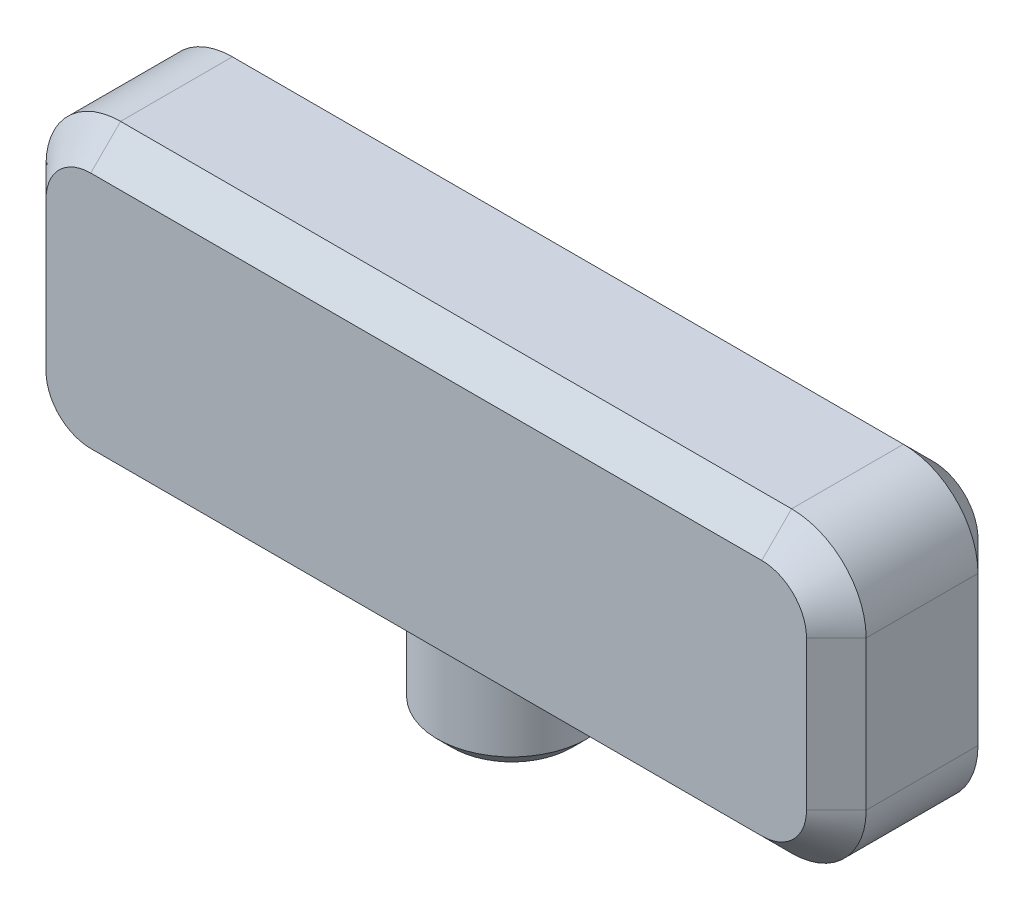
from build123d import *

# Parameters (mm, degrees)
SKETCH1_W                = 139.7
SKETCH1_H                = 50.8
SKETCH1_R                = 5.715
BOSS_EXTRUDE1_DEPTH      = 22.86
BOSS_EXTRUDE2_START      = 22.86
BOSS_EXTRUDE2_OUTLINE_W  = 139.7
BOSS_EXTRUDE2_OUTLINE_H  = 50.8
BOSS_EXTRUDE2_DEPTH      = 6.35
EXTRUDE_THIN1_START      = -7.62
SKETCH1_4_R              = 13.335
SKETCH1_4_R_2            = 5.715
EXTRUDE_THIN1_DEPTH      = 7.62
FILLET1_R                = 12.7
CHAMFER1_SIZE            = 5.08
CHAMFER3_SIZE            = 2.54
BOSS_EXTRUDE3_DEPTH      = 12.7
BOSS_EXTRUDE3_DEPTH_BACK = 12.7
SKETCH2_R                = 12.7
SKETCH2_R_2              = 5.08
CUT_EXTRUDE1_START       = -26.67
SKETCH2_2_R              = 5.08
CUT_EXTRUDE1_DEPTH       = 26.67
CHAMFER2_SIZE            = 2.54


# Read off the part's stored shape, not the designer's step: Boss-Extrude2
with BuildPart() as part:
    # Sketch1 → Boss-Extrude1 (new body)
    with BuildSketch(Plane.XY):
        Rectangle(SKETCH1_W, SKETCH1_H)
        with Locations((44.45, 0)):
            Circle(SKETCH1_R, mode=Mode.SUBTRACT)
        with Locations((-44.45, 0)):
            Circle(SKETCH1_R, mode=Mode.SUBTRACT)
    extrude(amount=BOSS_EXTRUDE1_DEPTH)

    # Boss-Extrude2 outline → Boss-Extrude2 (add)
    with BuildSketch(Plane.XY.offset(BOSS_EXTRUDE2_START)):
        Rectangle(BOSS_EXTRUDE2_OUTLINE_W, BOSS_EXTRUDE2_OUTLINE_H)
    extrude(amount=BOSS_EXTRUDE2_DEPTH)

    # Sketch1<4> → Extrude-Thin1 (add)
    # profile 1 of 2: a face of its own
    with BuildSketch(Plane.XY.offset(EXTRUDE_THIN1_START)):
        with Locations((44.45, 0)):
            Circle(SKETCH1_4_R)
        with Locations((44.45, 0)):
            Circle(SKETCH1_4_R_2, mode=Mode.SUBTRACT)
    # profile 2 of 2: a face of its own
    with BuildSketch(Plane.XY.offset(EXTRUDE_THIN1_START)):
        with Locations((-44.45, 0)):
            Circle(SKETCH1_4_R)
        with Locations((-44.45, 0)):
            Circle(SKETCH1_4_R_2, mode=Mode.SUBTRACT)
    extrude(amount=EXTRUDE_THIN1_DEPTH)

    # Fillet1
    fillet1_edges = [part.edges().sort_by_distance(p)[0] for p in [
        (-69.85, 25.4, 14.605),
        (69.85, 25.4, 14.605),
        (69.85, -25.4, 14.605),
        (-69.85, -25.4, 14.605),
    ]]
    fillet(fillet1_edges, radius=FILLET1_R)

    # Chamfer1
    chamfer1_edges = [part.edges().sort_by_distance(p)[0] for p in [
        (0, -25.4, 0),
        (0, -25.4, 29.21),
        (-69.85, 0, 0),
        (0, 25.4, 0),
        (69.85, 0, 0),
        (-66.130256121, 21.680256121, 0),
        (66.130256121, 21.680256121, 0),
        (66.130256121, -21.680256121, 0),
        (-66.130256121, -21.680256121, 0),
        (-69.85, 0, 29.21),
        (69.85, 0, 29.21),
        (0, 25.4, 29.21),
        (-66.130256121, 21.680256121, 29.21),
        (66.130256121, 21.680256121, 29.21),
        (66.130256121, -21.680256121, 29.21),
        (-66.130256121, -21.680256121, 29.21),
    ]]
    chamfer(chamfer1_edges, length=CHAMFER1_SIZE)

    # Chamfer3
    chamfer3_edges = [part.edges().sort_by_distance(p)[0] for p in [
        (31.115, 0, -7.62),
        (38.735, 0, -7.62),
        (-57.785, 0, -7.62),
        (-50.165, 0, -7.62),
    ]]
    chamfer(chamfer3_edges, length=CHAMFER3_SIZE)

    # Sketch2 → Boss-Extrude3 (add, two sides: drawn at the far end of the back side and taken through both)
    with BuildSketch(Plane.XZ.offset(25.4).offset(-BOSS_EXTRUDE3_DEPTH_BACK)):
        with Locations((0, 14.605)):
            Circle(SKETCH2_R)
        with Locations((0, 14.605)):
            Circle(SKETCH2_R_2, mode=Mode.SUBTRACT)
    extrude(amount=BOSS_EXTRUDE3_DEPTH + BOSS_EXTRUDE3_DEPTH_BACK)

    # Sketch2<2> → Cut-Extrude1 (cut)
    with BuildSketch(Plane.XZ.offset(25.4).offset(CUT_EXTRUDE1_START)):
        with Locations((0, 14.605)):
            Circle(SKETCH2_2_R)
    extrude(amount=CUT_EXTRUDE1_DEPTH, mode=Mode.SUBTRACT)

    # Chamfer2
    chamfer2_edges = [part.edges().sort_by_distance(p)[0] for p in [
        (-12.7, -38.1, 14.605),
    ]]
    chamfer(chamfer2_edges, length=CHAMFER2_SIZE)


solid = part.part
